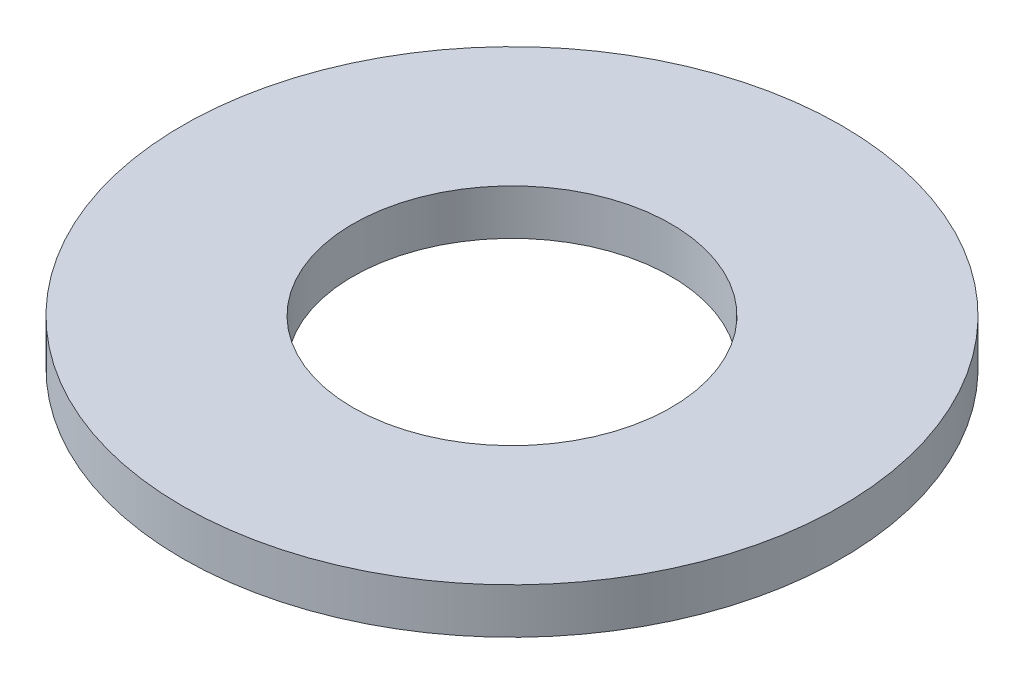
from build123d import *

# Parameters (mm, degrees)
SKETCH1_R           = 72.5
BOSS_EXTRUDE1_DEPTH = 10
SKETCH2_R           = 35
CUT_EXTRUDE1_DEPTH  = 104.01698889


with BuildPart() as part:
    # Sketch1 → Boss-Extrude1 (new body)
    with BuildSketch(Plane(origin=(0, 0, 0), x_dir=(1, 0, 0), z_dir=(0, 1, 0))):
        Circle(SKETCH1_R)
    extrude(amount=BOSS_EXTRUDE1_DEPTH)

    # Sketch2 → Cut-Extrude1 (cut, through all)
    with BuildSketch(Plane(origin=(0, 0, 0), x_dir=(1, 0, 0), z_dir=(0, 1, 0))):
        Circle(SKETCH2_R)
    extrude(amount=CUT_EXTRUDE1_DEPTH, mode=Mode.SUBTRACT)


solid = part.part
